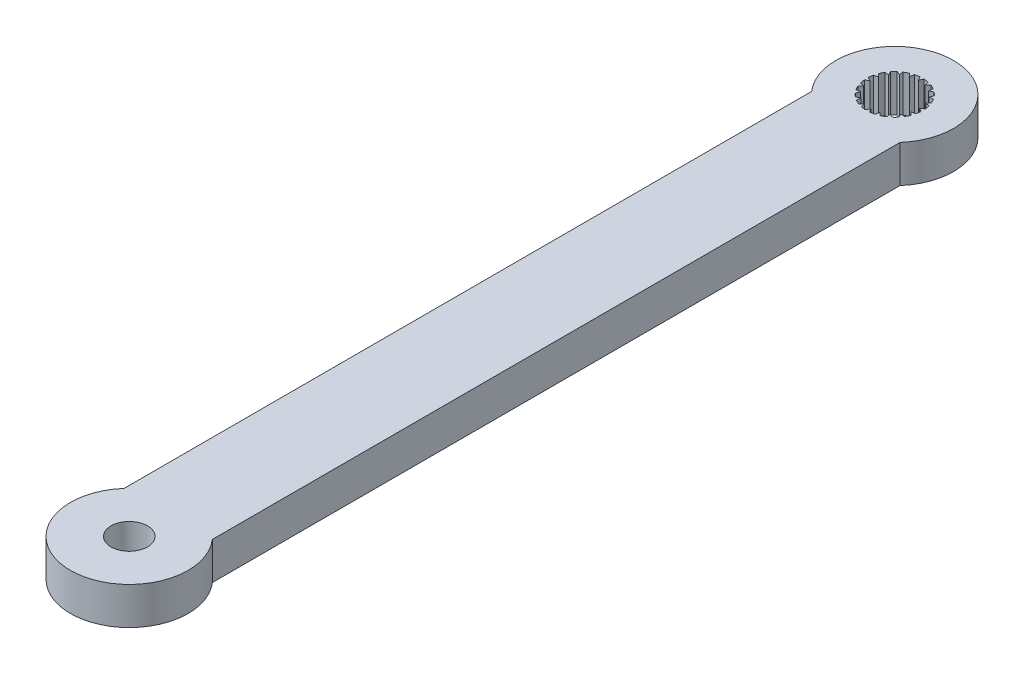
from build123d import *

# Parameters (mm, degrees)
SKETCH1_R           = 1.55
BOSS_EXTRUDE1_DEPTH = 3.175


with BuildPart() as part:
    # Sketch1 → Boss-Extrude1 (new body)
    with BuildSketch(Plane(origin=(0, 0, 0), x_dir=(1, 0, 0), z_dir=(0, 1, 0))):
        with BuildLine():
            Line((-3.75, -61.692810861), (-3.75, -3.307189139))
            ThreePointArc((-3.75, -3.307189139), (0, 5), (3.75, -3.307189139))
            Line((3.75, -3.307189139), (3.75, -61.692810861))
            ThreePointArc((3.75, -61.692810861), (0, -70), (-3.75, -61.692810861))
        make_face()
        with Locations((0, -65)):
            Circle(SKETCH1_R, mode=Mode.SUBTRACT)
        with BuildLine():
            Line((-1.1780337, -1.700732363), (-1.208757337, -2.044390056))
            ThreePointArc((-1.208757337, -2.044390056), (-1.030272644, -2.13989796), (-0.844303129, -2.219859731))
            Line((-0.844303129, -2.219859731), (-0.594821423, -1.98152503))
            Line((-0.594821423, -1.98152503), (-0.517845272, -2.317857044))
            ThreePointArc((-0.517845272, -2.317857044), (-0.318582676, -2.353535655), (-0.11700561, -2.372116078))
            Line((-0.11700561, -2.372116078), (0.046616118, -2.06835222))
            Line((0.046616118, -2.06835222), (0.223757097, -2.364436035))
            ThreePointArc((0.223757097, -2.364436035), (0.424292384, -2.336792882), (0.621745233, -2.292173175))
            Line((0.621745233, -2.292173175), (0.683490549, -1.952714684))
            Line((0.683490549, -1.952714684), (0.943456562, -2.179567553))
            ThreePointArc((0.943456562, -2.179567553), (1.12563475, -2.09130854), (1.29963532, -1.987856392))
            Line((1.29963532, -1.987856392), (1.253460163, -1.64593183))
            Line((1.253460163, -1.64593183), (1.570803925, -1.781347813))
            ThreePointArc((1.570803925, -1.781347813), (1.716792143, -1.641112348), (1.850308047, -1.488954375))
            Line((1.850308047, -1.488954375), (1.700732363, -1.1780337))
            Line((1.700732363, -1.1780337), (2.044390056, -1.208757337))
            ThreePointArc((2.044390056, -1.208757337), (2.13989796, -1.030272644), (2.219859731, -0.844303129))
            Line((2.219859731, -0.844303129), (1.98152503, -0.594821423))
            Line((1.98152503, -0.594821423), (2.317857044, -0.517845272))
            ThreePointArc((2.317857044, -0.517845272), (2.353535655, -0.318582676), (2.372116078, -0.11700561))
            Line((2.372116078, -0.11700561), (2.06835222, 0.046616118))
            Line((2.06835222, 0.046616118), (2.364436035, 0.223757097))
            ThreePointArc((2.364436035, 0.223757097), (2.336792882, 0.424292384), (2.292173175, 0.621745233))
            Line((2.292173175, 0.621745233), (1.952714684, 0.683490549))
            Line((1.952714684, 0.683490549), (2.179567553, 0.943456562))
            ThreePointArc((2.179567553, 0.943456562), (2.09130854, 1.12563475), (1.987856392, 1.29963532))
            Line((1.987856392, 1.29963532), (1.64593183, 1.253460163))
            Line((1.64593183, 1.253460163), (1.781347813, 1.570803925))
            ThreePointArc((1.781347813, 1.570803925), (1.641112348, 1.716792143), (1.488954375, 1.850308047))
            Line((1.488954375, 1.850308047), (1.1780337, 1.700732363))
            Line((1.1780337, 1.700732363), (1.208757337, 2.044390056))
            ThreePointArc((1.208757337, 2.044390056), (1.030272644, 2.13989796), (0.844303129, 2.219859731))
            Line((0.844303129, 2.219859731), (0.594821423, 1.98152503))
            Line((0.594821423, 1.98152503), (0.517845272, 2.317857044))
            ThreePointArc((0.517845272, 2.317857044), (0.318582676, 2.353535655), (0.11700561, 2.372116078))
            Line((0.11700561, 2.372116078), (-0.046616118, 2.06835222))
            Line((-0.046616118, 2.06835222), (-0.223757097, 2.364436035))
            ThreePointArc((-0.223757097, 2.364436035), (-0.424292384, 2.336792882), (-0.621745233, 2.292173175))
            Line((-0.621745233, 2.292173175), (-0.683490549, 1.952714684))
            Line((-0.683490549, 1.952714684), (-0.943456562, 2.179567553))
            ThreePointArc((-0.943456562, 2.179567553), (-1.12563475, 2.09130854), (-1.29963532, 1.987856392))
            Line((-1.29963532, 1.987856392), (-1.253460163, 1.64593183))
            Line((-1.253460163, 1.64593183), (-1.570803925, 1.781347813))
            ThreePointArc((-1.570803925, 1.781347813), (-1.716792143, 1.641112348), (-1.850308047, 1.488954375))
            Line((-1.850308047, 1.488954375), (-1.700732363, 1.1780337))
            Line((-1.700732363, 1.1780337), (-2.044390056, 1.208757337))
            ThreePointArc((-2.044390056, 1.208757337), (-2.13989796, 1.030272644), (-2.219859731, 0.844303129))
            Line((-2.219859731, 0.844303129), (-1.98152503, 0.594821423))
            Line((-1.98152503, 0.594821423), (-2.317857044, 0.517845272))
            ThreePointArc((-2.317857044, 0.517845272), (-2.353535655, 0.318582676), (-2.372116078, 0.11700561))
            Line((-2.372116078, 0.11700561), (-2.06835222, -0.046616118))
            Line((-2.06835222, -0.046616118), (-2.364436035, -0.223757097))
            ThreePointArc((-2.364436035, -0.223757097), (-2.336792882, -0.424292384), (-2.292173175, -0.621745233))
            Line((-2.292173175, -0.621745233), (-1.952714684, -0.683490549))
            Line((-1.952714684, -0.683490549), (-2.179567553, -0.943456562))
            ThreePointArc((-2.179567553, -0.943456562), (-2.09130854, -1.12563475), (-1.987856392, -1.29963532))
            Line((-1.987856392, -1.29963532), (-1.64593183, -1.253460163))
            Line((-1.64593183, -1.253460163), (-1.781347813, -1.570803925))
            ThreePointArc((-1.781347813, -1.570803925), (-1.641112348, -1.716792143), (-1.488954375, -1.850308047))
            Line((-1.488954375, -1.850308047), (-1.1780337, -1.700732363))
        make_face(mode=Mode.SUBTRACT)
    extrude(amount=BOSS_EXTRUDE1_DEPTH)


solid = part.part
